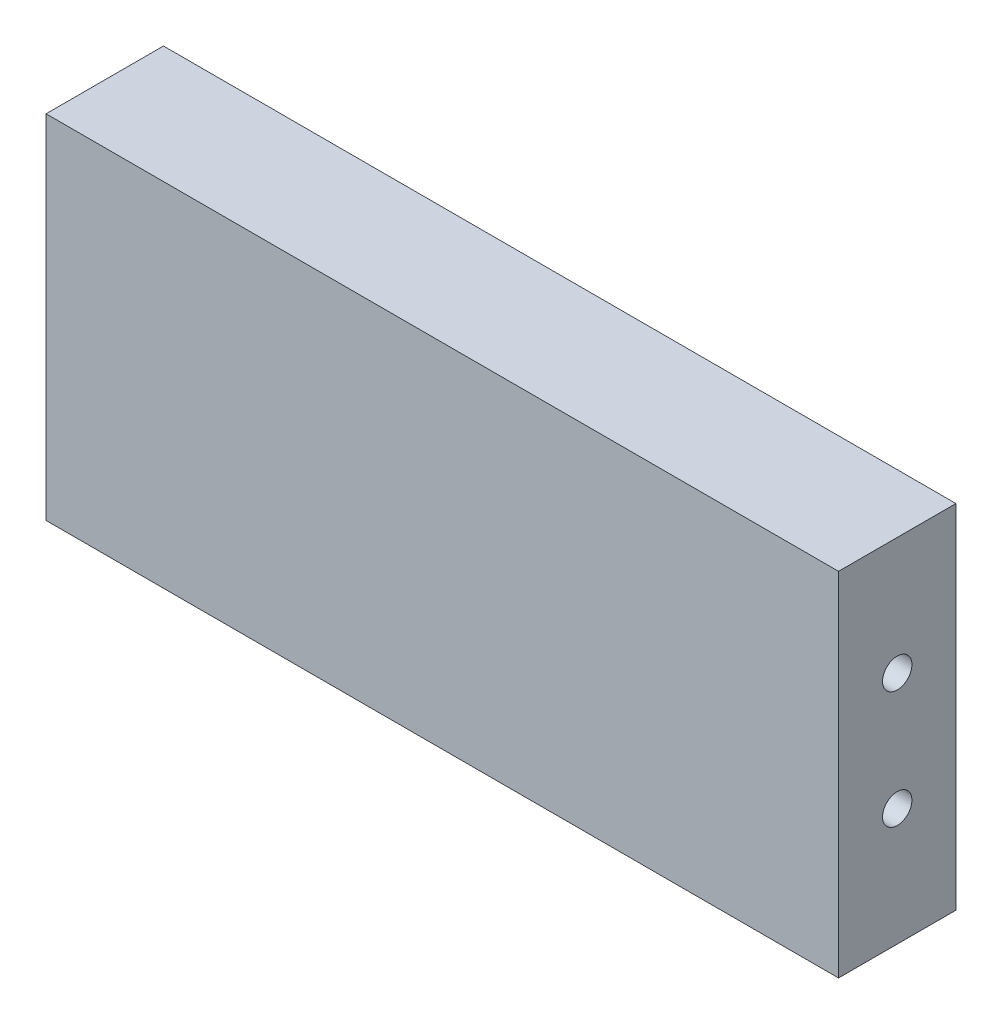
from build123d import *

# Parameters (mm, degrees)
SKETCH1_W           = 135
SKETCH1_H           = 60
BOSS_EXTRUDE1_DEPTH = 20
SKETCH2_W           = 125
SKETCH2_H           = 49.960975696
CUT_EXTRUDE1_DEPTH  = 15
SKETCH5_R           = 2.5
CUT_EXTRUDE3_DEPTH  = 140.731886125


with BuildPart() as part:
    # Sketch1 → Boss-Extrude1 (new body)
    with BuildSketch(Plane.XY):
        Rectangle(SKETCH1_W, SKETCH1_H)
    extrude(amount=BOSS_EXTRUDE1_DEPTH)

    # Sketch2 → Cut-Extrude1 (cut)
    with BuildSketch(Plane(origin=(0, 0, 0), x_dir=(-1, 0, 0), z_dir=(0, 0, -1))):
        Rectangle(SKETCH2_W, SKETCH2_H)
    extrude(amount=-CUT_EXTRUDE1_DEPTH, mode=Mode.SUBTRACT)

    # Sketch5 → Cut-Extrude3 (cut, through all)
    with BuildSketch(Plane(origin=(67.5, 0, 0), x_dir=(0, 0, -1), z_dir=(1, 0, 0))):
        with Locations((-10, 10)):
            Circle(SKETCH5_R)
        with Locations((-10, -10)):
            Circle(SKETCH5_R)
    extrude(amount=-CUT_EXTRUDE3_DEPTH, mode=Mode.SUBTRACT)


solid = part.part
